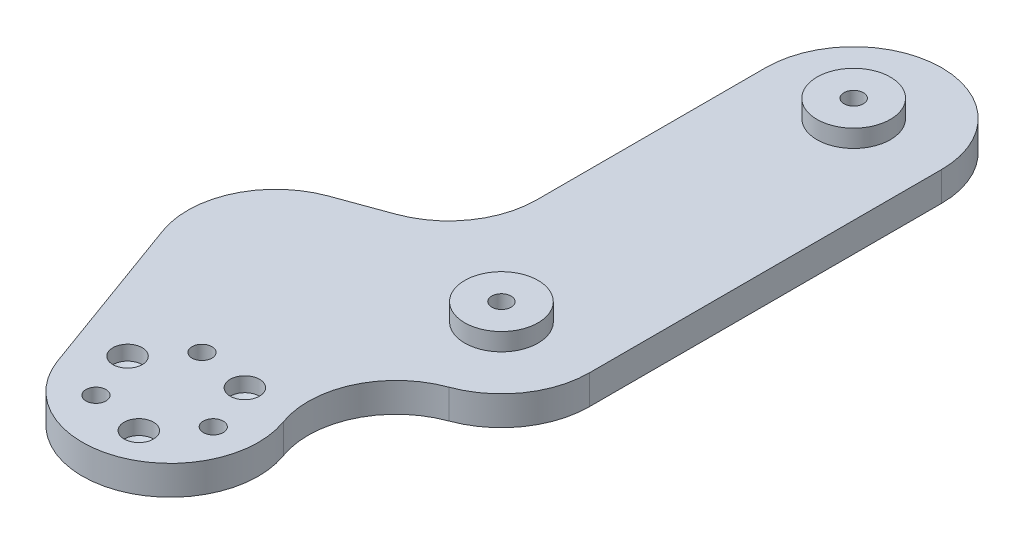
from build123d import *

# Parameters (mm, degrees)
EXTRUDE_1_DEPTH              = 5
SKETCH_2_R                   = 6.25
EXTRUDE_2_DEPTH              = 3
HOLE_WIZARD_M4_1_D           = 3.3
HOLE_WIZARD_M4_1_DEPTH       = 5
HOLE_WIZARD_M4_1_TIP         = 0.991420021
EXTRUDE_3_DEPTH              = 5
EXTRUDE_4_DEPTH              = 5
HOLE_WIZARD_M3_1_D           = 3.4
HOLE_WIZARD_M3_1_CBORE_D     = 6.5
HOLE_WIZARD_M3_1_CBORE_DEPTH = 2
PATTERN_CIRCULAR_2_COUNT     = 3
PATTERN_CIRCULAR_3_COUNT     = 3
FILLET_1_R                   = 15


with BuildPart() as part:
    # 스케치1 → 보스-돌출1 (new body)
    with BuildSketch(Plane(origin=(0, 0, 0), x_dir=(1, 0, 0), z_dir=(0, 1, 0))):
        with BuildLine():
            Line((-15, 0), (-15, 60))
            ThreePointArc((-15, 60), (0, 75), (15, 60))
            Line((15, 60), (15, 0))
            ThreePointArc((15, 0), (0, -15), (-15, 0))
        make_face()
    extrude(amount=EXTRUDE_1_DEPTH)

    # 스케치2 → 보스-돌출2 (add)
    with BuildSketch(Plane(origin=(0, 5, 0), x_dir=(1, 0, 0), z_dir=(0, 1, 0))):
        with Locations(Location((0, 60, 0), (0, 0, 270))):
            Circle(SKETCH_2_R)
        with Locations(Location((0, 0, 0), (0, 0, 270))):
            Circle(SKETCH_2_R)
    extrude(amount=EXTRUDE_2_DEPTH)

    # M4 탭을 위한 탭 드릴1
    with Locations(Plane(origin=(0, 8, 0), x_dir=(1, 0, 0), z_dir=(0, 1, 0))):
        with Locations((0, 0), (0, 60)):
            Hole(HOLE_WIZARD_M4_1_D / 2, depth=HOLE_WIZARD_M4_1_DEPTH)
            with Locations((0, 0, -(HOLE_WIZARD_M4_1_DEPTH + HOLE_WIZARD_M4_1_TIP / 2))):  # 118° drill point
                Cone(0, HOLE_WIZARD_M4_1_D / 2, HOLE_WIZARD_M4_1_TIP, mode=Mode.SUBTRACT)

    # 스케치9 → 보스-돌출3 (add)
    with BuildSketch(Plane.XZ):
        with BuildLine():
            Line((-5.13030215, -14.095389312), (-33.321080773, -3.834785012))
            ThreePointArc((-33.321080773, -3.834785012), (-42.286167935, 15.39090645), (-23.060476474, 24.355993612))
            Line((-23.060476474, 24.355993612), (5.13030215, 14.095389312))
            ThreePointArc((5.13030215, 14.095389312), (14.095389312, -5.13030215), (-5.13030215, -14.095389312))
        make_face()
    extrude(amount=-EXTRUDE_3_DEPTH)

    # 스케치10 → 보스-돌출4 (add)
    with BuildSketch(Plane.XZ):
        with BuildLine():
            Line((-42.286167935, 15.39090645), (-32.025563636, 43.581685073))
            ThreePointArc((-32.025563636, 43.581685073), (-12.799872174, 52.546772235), (-3.834785012, 33.321080773))
            Line((-3.834785012, 33.321080773), (-14.095389312, 5.13030215))
            ThreePointArc((-14.095389312, 5.13030215), (-33.321080773, -3.834785012), (-42.286167935, 15.39090645))
        make_face()
    extrude(amount=-EXTRUDE_4_DEPTH)

    # M3 육각 소켓 머리 캡 나사용 카운터보어1 (through all)
    with Locations(Plane(origin=(0, 0, 0), x_dir=(-1, 0, 0), z_dir=(0, -1, 0))):
        with Locations((21.008355614, -29.994149336)):
            hole_wizard_m3_1 = CounterBoreHole(HOLE_WIZARD_M3_1_D / 2, HOLE_WIZARD_M3_1_CBORE_D / 2, HOLE_WIZARD_M3_1_CBORE_DEPTH)

    # 원형 패턴2: M3 육각 소켓 머리 캡 나사용 카운터보어1 ×3 about axis
    pattern_circular_2_axis = Axis((-17.930174324, 0, 38.451382923), (0, 1, 0))
    for i in range(1, PATTERN_CIRCULAR_2_COUNT):
        add(hole_wizard_m3_1.rotate(pattern_circular_2_axis, i * 360 / PATTERN_CIRCULAR_2_COUNT), mode=Mode.SUBTRACT)

    # 스케치18 → Ø5.0mm 맞춤핀 구멍1 (revolve, cut)
    with BuildSketch(Plane(origin=(-14.851993034, 5, 46.90861651), x_dir=(0, 0, 1), z_dir=(1, 0, 0))):
        Polygon((0, 0), (0, 4.002151548), (2.5, 2.5), (2.5, 0), align=None)
    f_5_0mm_1 = revolve(axis=Axis((-14.851993034, 11.35, 46.90861651), (0, -1, 0)), mode=Mode.SUBTRACT)

    # 원형 패턴3: Ø5.0mm 맞춤핀 구멍1 ×3 about axis
    pattern_circular_3_axis = Axis((-17.930174324, 0, 38.451382923), (0, 1, 0))
    for i in range(1, PATTERN_CIRCULAR_3_COUNT):
        add(f_5_0mm_1.rotate(pattern_circular_3_axis, i * 360 / PATTERN_CIRCULAR_3_COUNT), mode=Mode.SUBTRACT)

    # 필렛1
    fillet_1_edges = [part.edges().sort_by_distance(p)[0] for p in [
        (-8.965087162, 2.5, 19.225691462),
        (-15, 2.5, -10.503113073),
    ]]
    fillet(fillet_1_edges, radius=FILLET_1_R - 0.0001)  # a hair under: the kernel refuses the full size


solid = part.part
